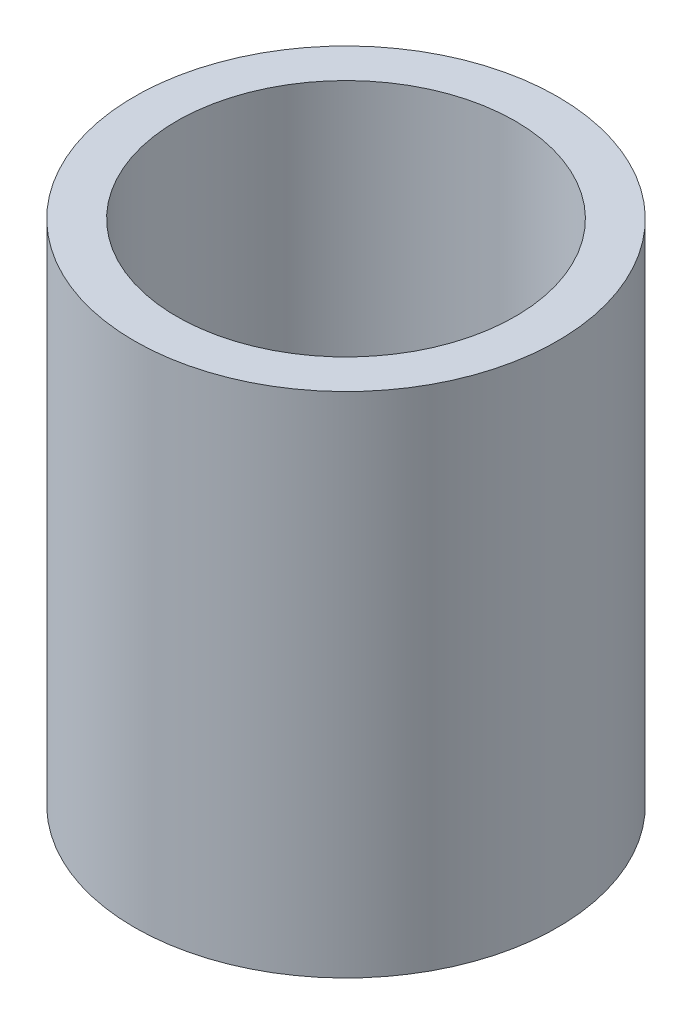
from build123d import *

# Parameters (mm, degrees)
SKETCH1_R           = 7.9375
SKETCH1_R_2         = 6.35
BOSS_EXTRUDE1_DEPTH = 19.05


with BuildPart() as part:
    # Sketch1 → Boss-Extrude1 (new body)
    with BuildSketch(Plane(origin=(0, 0, 0), x_dir=(1, 0, 0), z_dir=(0, 1, 0))):
        Circle(SKETCH1_R)
        Circle(SKETCH1_R_2, mode=Mode.SUBTRACT)
    extrude(amount=BOSS_EXTRUDE1_DEPTH)


solid = part.part
